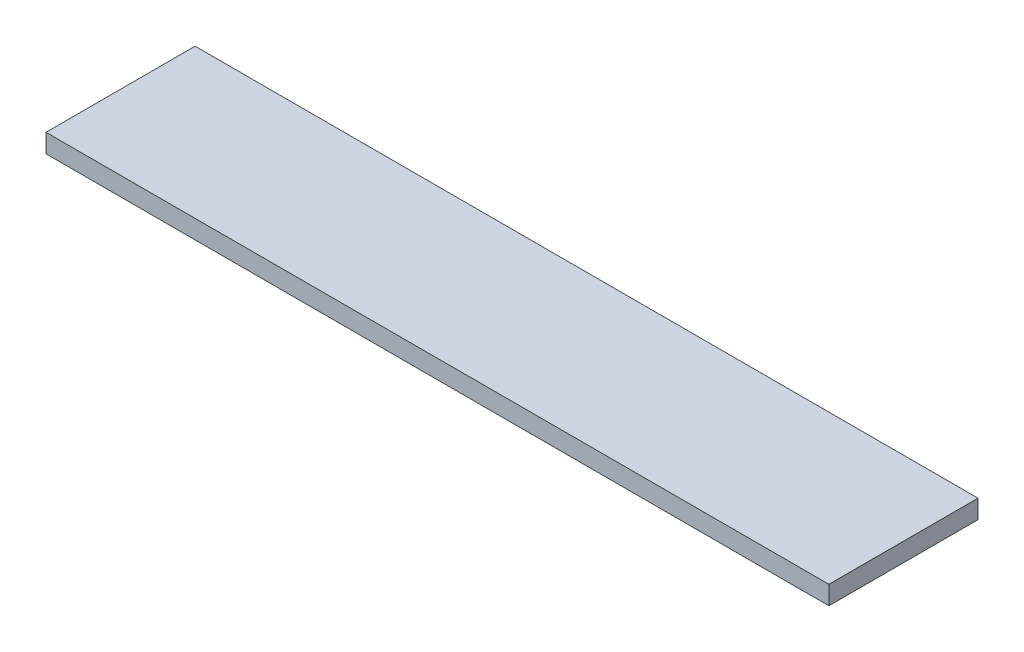
from build123d import *

# Parameters (mm, degrees)
SKETCH1_W           = 266.7
SKETCH1_H           = 50.8
BOSS_EXTRUDE1_DEPTH = 6.35


with BuildPart() as part:
    # Sketch1 → Boss-Extrude1 (new body)
    with BuildSketch(Plane(origin=(0, 0, 0), x_dir=(1, 0, 0), z_dir=(0, 1, 0))):
        with Locations((133.35, 25.4)):
            Rectangle(SKETCH1_W, SKETCH1_H)
    extrude(amount=BOSS_EXTRUDE1_DEPTH)


solid = part.part
